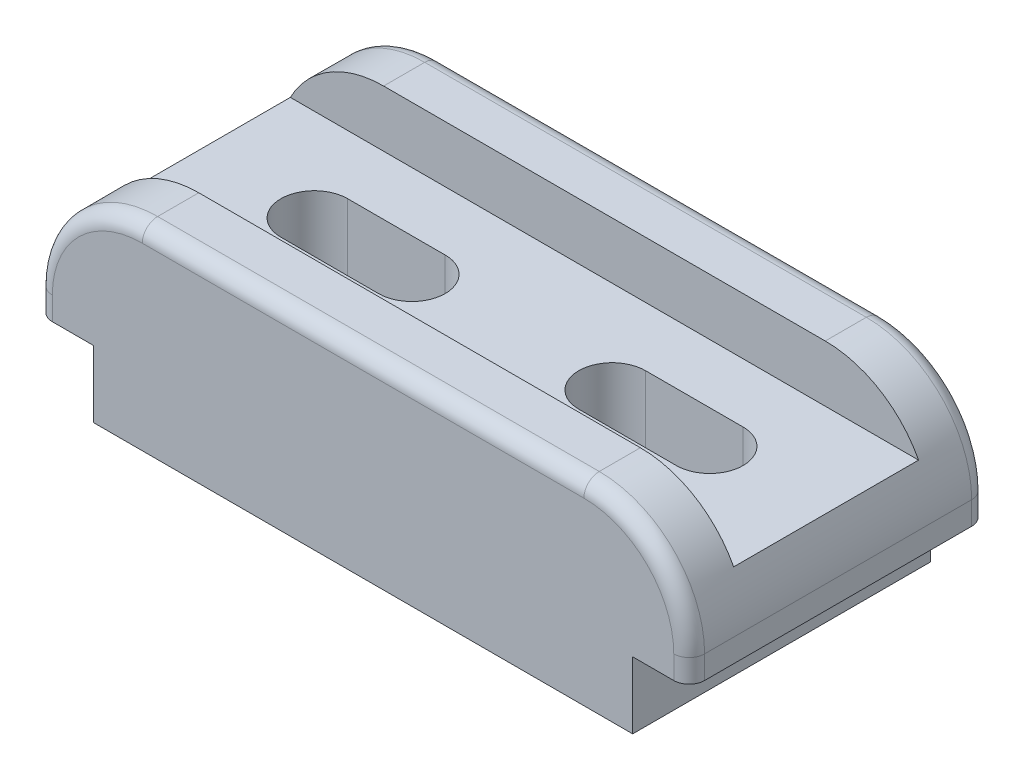
from build123d import *

# Parameters (mm, degrees)
ESQUISSE1_W                 = 127
ESQUISSE1_H                 = 58
CREATION_PREMIER_CUBE_DEPTH = 38
ESQUISSE2_W                 = 11
ESQUISSE2_H                 = 58
ENLEVE_RECLANGLE_BAS_DEPTH  = 13
CONG_15_START               = -30
CONG_15_DEPTH               = 60
CONG_16_START               = -30
CONG_16_DEPTH               = 60
ENL_V_MAT_EXTRU_7_DEPTH     = 11
ENL_V_MAT_EXTRU_10_DEPTH    = 50
ENL_V_MAT_EXTRU_11_DEPTH    = 50
CONG_18_R                   = 3


with BuildPart() as part:
    # Esquisse1 → Creation premier cube (new body)
    with BuildSketch(Plane(origin=(0, 0, 0), x_dir=(1, 0, 0), z_dir=(0, 1, 0))):
        Rectangle(ESQUISSE1_W, ESQUISSE1_H)
    extrude(amount=CREATION_PREMIER_CUBE_DEPTH)

    # Esquisse2 → Enleve reclangle bas (cut)
    with BuildSketch(Plane.XZ):
        with Locations((58, 0)):
            Rectangle(ESQUISSE2_W, ESQUISSE2_H)
        with Locations((-58, 0)):
            Rectangle(ESQUISSE2_W, ESQUISSE2_H)
    extrude(amount=-ENLEVE_RECLANGLE_BAS_DEPTH, mode=Mode.SUBTRACT)

    # Congé15: read off the stored shape, not the designer's step
    # Congé15 outline → Congé15 (cut)
    with BuildSketch(Plane.XY.offset(CONG_15_START)):
        with BuildLine():
            Line((-63.5, 38), (-63.5, 17.493903346))
            ThreePointArc((-63.5, 17.493903346), (-57.493903346, 31.993903346), (-42.993903346, 38))
            Line((-42.993903346, 38), (-63.5, 38))
        make_face()
    extrude(amount=CONG_15_DEPTH, mode=Mode.SUBTRACT)

    # Congé16: read off the stored shape, not the designer's step
    # Congé16 outline → Congé16 (cut)
    with BuildSketch(Plane.XY.offset(CONG_16_START)):
        with BuildLine():
            ThreePointArc((42.993903346, 38), (57.493903346, 31.993903346), (63.5, 17.493903346))
            Line((63.5, 17.493903346), (63.5, 38))
            Line((63.5, 38), (42.993903346, 38))
        make_face()
    extrude(amount=CONG_16_DEPTH, mode=Mode.SUBTRACT)

    # Esquisse9 → Enlèv. mat.-Extru.7 (cut)
    with BuildSketch(Plane(origin=(0, 38, 0), x_dir=(1, 0, 0), z_dir=(0, 1, 0))):
        Polygon((-0.380283646, 18), (-63.5, 18), (-63.5, -18), (-0.380283646, -18), (63.5, -18), (63.5, 18), align=None)
    extrude(amount=-ENL_V_MAT_EXTRU_7_DEPTH, mode=Mode.SUBTRACT)

    # Esquisse10 → Enlèv. mat.-Extru.10 (cut)
    with BuildSketch(Plane(origin=(0, 27, 0), x_dir=(1, 0, 0), z_dir=(0, 1, 0))):
        with BuildLine():
            Line((-38.5, -6.5), (-19.5, -6.5))
            ThreePointArc((-19.5, -6.5), (-13, 0), (-19.5, 6.5))
            Line((-19.5, 6.5), (-38.5, 6.5))
            ThreePointArc((-38.5, 6.5), (-45, 0), (-38.5, -6.5))
        make_face()
    extrude(amount=-ENL_V_MAT_EXTRU_10_DEPTH, mode=Mode.SUBTRACT)

    # Esquisse10<3> → Enlèv. mat.-Extru.11 (cut)
    with BuildSketch(Plane(origin=(0, 27, 0), x_dir=(1, 0, 0), z_dir=(0, 1, 0))):
        with BuildLine():
            Line((38.5, -6.5), (19.5, -6.5))
            ThreePointArc((19.5, -6.5), (13, 0), (19.5, 6.5))
            Line((19.5, 6.5), (38.5, 6.5))
            ThreePointArc((38.5, 6.5), (45, 0), (38.5, -6.5))
        make_face()
        with BuildLine():
            Line((-38.5, -6.5), (-19.5, -6.5))
            ThreePointArc((-19.5, -6.5), (-13, 0), (-19.5, 6.5))
            Line((-19.5, 6.5), (-38.5, 6.5))
            ThreePointArc((-38.5, 6.5), (-45, 0), (-38.5, -6.5))
        make_face()
    extrude(amount=-ENL_V_MAT_EXTRU_11_DEPTH, mode=Mode.SUBTRACT)

    # Congé18
    cong_18_edges = [part.edges().sort_by_distance(p)[0] for p in [
        (-63.5, 15.246951673, -29),
        (-63.5, 15.246951673, 29),
        (0, 38, 29),
        (-57.493903346, 31.993903346, 29),
        (-57.493903346, 31.993903346, -29),
        (63.5, 15.246951673, -29),
        (63.5, 15.246951673, 29),
        (0, 38, -29),
        (57.493903346, 31.993903346, -29),
        (57.493903346, 31.993903346, 29),
    ]]
    fillet(cong_18_edges, radius=CONG_18_R)


solid = part.part
